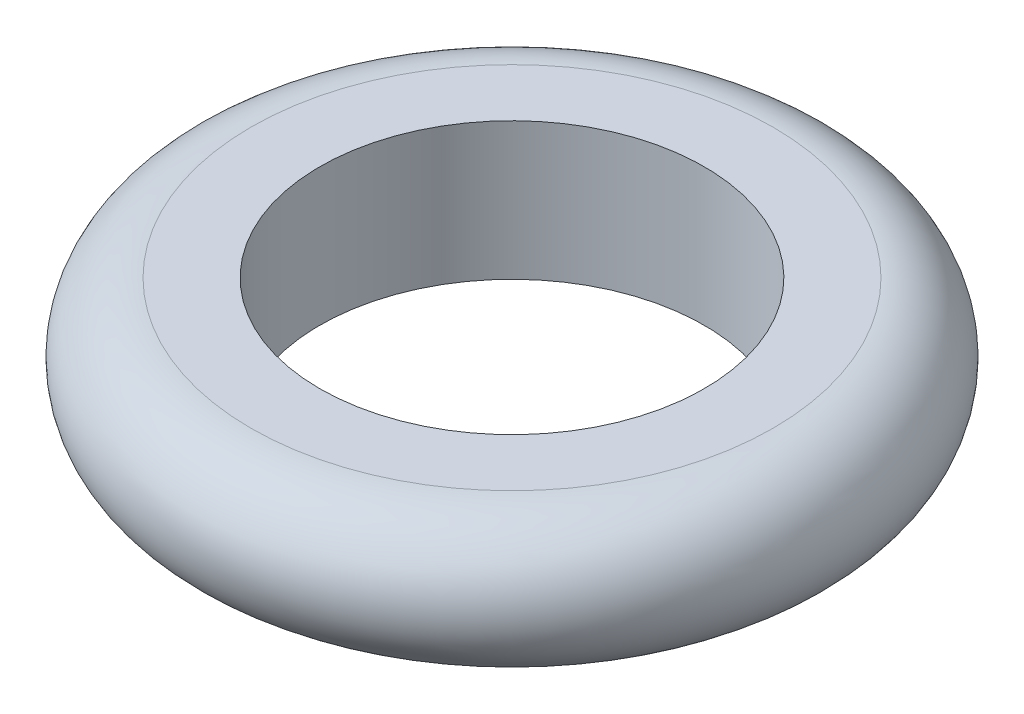
from build123d import *

# Parameters (mm, degrees)
SKETCH1_R           = 120
SKETCH1_R_2         = 70
BOSS_EXTRUDE1_DEPTH = 50
FILLET2_R           = 25


with BuildPart() as part:
    # Sketch1 → Boss-Extrude1 (new body)
    with BuildSketch(Plane(origin=(0, 0, 0), x_dir=(1, 0, 0), z_dir=(0, 1, 0))):
        with Locations(Location((0, 0, 0), (0, 0, 270))):
            Circle(SKETCH1_R)
        with Locations(Location((0, 0, 0), (0, 0, 270))):
            Circle(SKETCH1_R_2, mode=Mode.SUBTRACT)
    extrude(amount=BOSS_EXTRUDE1_DEPTH)

    # Fillet2
    fillet2_edges = [part.edges().sort_by_distance(p)[0] for p in [
        (0, 0, -120),
        (0, 50, -120),
    ]]
    fillet(fillet2_edges, radius=FILLET2_R - 0.0001)  # a hair under: the kernel refuses the full size


solid = part.part
